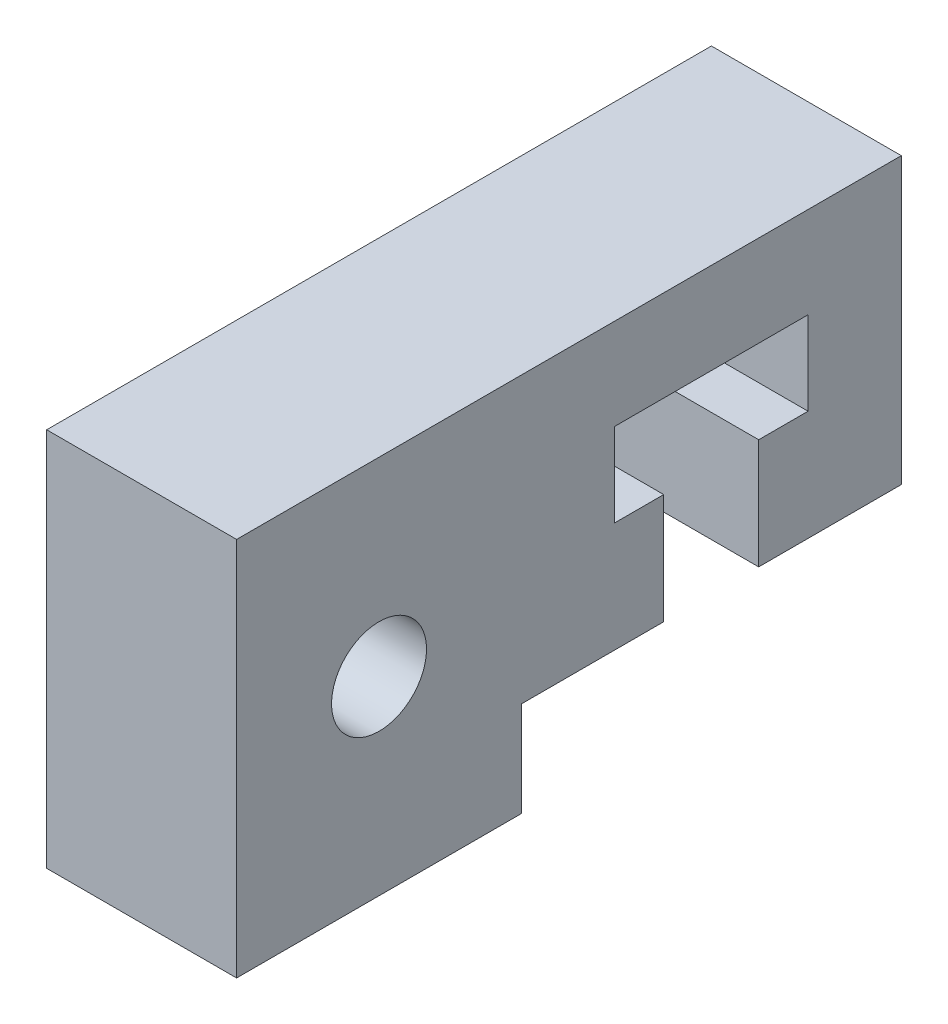
from build123d import *

# Parameters (mm, degrees)
BOSS_EXTRUDE1_DEPTH      = 3.175
BOSS_EXTRUDE1_DEPTH_BACK = 3.175
SKETCH2_R                = 1.5875


with BuildPart() as part:
    # Sketch2 → Boss-Extrude1 (new, two sides: drawn at the far end of the back side and taken through both)
    with BuildSketch(Plane(origin=(0, 0, 0), x_dir=(0, 0, -1), z_dir=(1, 0, 0)).offset(-BOSS_EXTRUDE1_DEPTH_BACK)):
        Polygon((-4.7625, 6.35), (-4.7625, -6.35), (4.7625, -6.35), (4.7625, -3.175), (9.51924613, -3.175), (9.51924613, 0.508), (7.86824613, 0.508), (7.86824613, 3.302), (14.34524613, 3.302), (14.34524613, 0.508), (12.69424613, 0.508), (12.69424613, -3.175), (17.4625, -3.175), (17.4625, 6.35), align=None)
        Circle(SKETCH2_R, mode=Mode.SUBTRACT)
    extrude(amount=BOSS_EXTRUDE1_DEPTH + BOSS_EXTRUDE1_DEPTH_BACK)


solid = part.part
